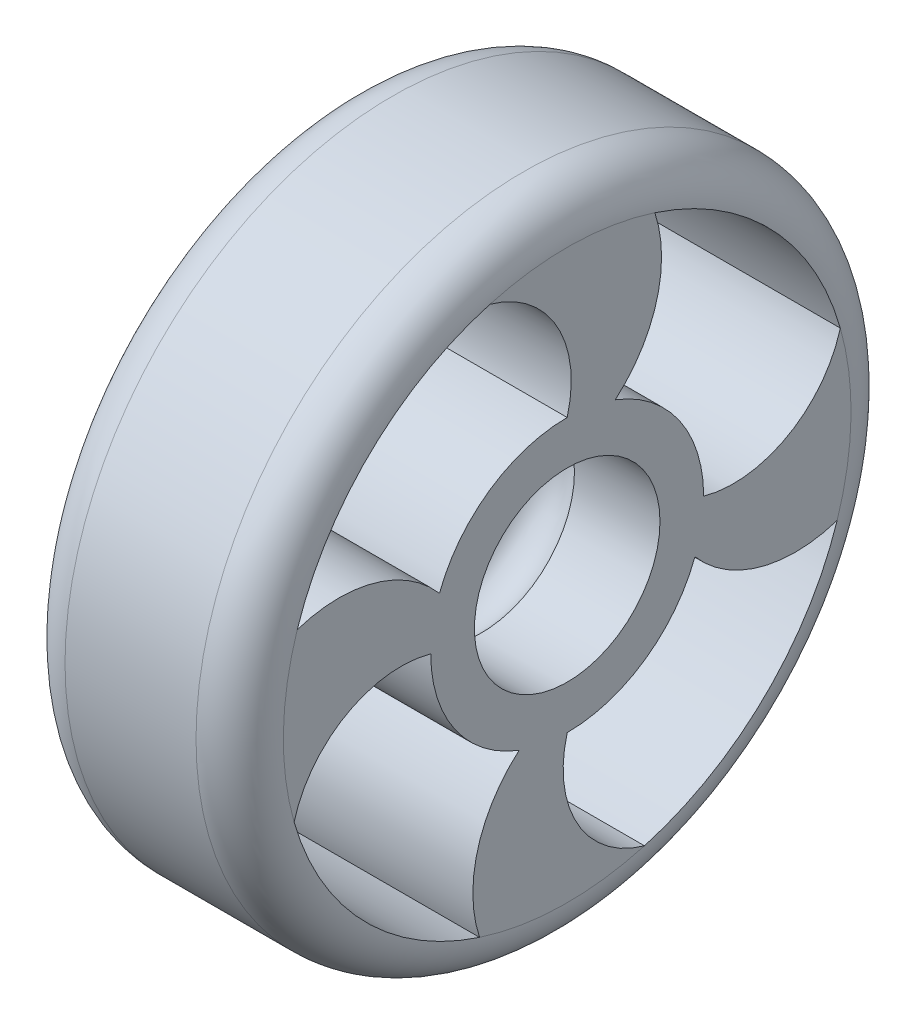
from build123d import *

# Parameters (mm, degrees)
SKETCH1_R           = 15.875
SKETCH1_R_2         = 10.795
BOSS_EXTRUDE1_DEPTH = 25.4
SKETCH2_R           = 38.1
BOSS_EXTRUDE2_DEPTH = 25.4
FILLET1_R           = 5.08


with BuildPart() as part:
    # Sketch1 → Boss-Extrude1 (new body)
    with BuildSketch(Plane(origin=(0, 0, 0), x_dir=(0, 0, -1), z_dir=(1, 0, 0))):
        with Locations(Location((0, 0, 0), (0, 0, 180))):
            Circle(SKETCH1_R)
        with Locations(Location((0, 0, 0), (0, 0, 180))):
            Circle(SKETCH1_R_2, mode=Mode.SUBTRACT)
    extrude(amount=BOSS_EXTRUDE1_DEPTH)

    # Sketch2 → Boss-Extrude2 (add)
    with BuildSketch(Plane.ZY):
        Circle(SKETCH2_R)
        with BuildLine():
            ThreePointArc((15.875, 0), (15.6190099, 2.839393375), (14.859295466, 5.587214267))
            ThreePointArc((14.859295466, 5.587214267), (22.431138125, 10.412171765), (31.406968253, 10.194250594))
            ThreePointArc((31.406968253, 10.194250594), (22.899884414, 23.788982615), (8.991124629, 31.772316219))
            ThreePointArc((8.991124629, 31.772316219), (1.203120323, 25.685780991), (0, 15.875))
            ThreePointArc((0, 15.875), (-2.839393375, 15.6190099), (-5.587214267, 14.859295466))
            ThreePointArc((-5.587214267, 14.859295466), (-10.412171765, 22.431138125), (-10.194250594, 31.406968253))
            ThreePointArc((-10.194250594, 31.406968253), (-23.788982615, 22.899884414), (-31.772316219, 8.991124629))
            ThreePointArc((-31.772316219, 8.991124629), (-25.685780991, 1.203120323), (-15.875, 0))
            ThreePointArc((-15.875, 0), (-15.6190099, -2.839393375), (-14.859295466, -5.587214267))
            ThreePointArc((-14.859295466, -5.587214267), (-22.431138125, -10.412171765), (-31.406968253, -10.194250594))
            ThreePointArc((-31.406968253, -10.194250594), (-22.899884414, -23.788982615), (-8.991124629, -31.772316219))
            ThreePointArc((-8.991124629, -31.772316219), (-1.203120323, -25.685780991), (0, -15.875))
            ThreePointArc((0, -15.875), (2.839393375, -15.6190099), (5.587214267, -14.859295466))
            ThreePointArc((5.587214267, -14.859295466), (10.412171765, -22.431138125), (10.194250594, -31.406968253))
            ThreePointArc((10.194250594, -31.406968253), (23.788982615, -22.899884414), (31.772316219, -8.991124629))
            ThreePointArc((31.772316219, -8.991124629), (25.685780991, -1.203120323), (15.875, 0))
        make_face(mode=Mode.SUBTRACT)
    extrude(amount=-BOSS_EXTRUDE2_DEPTH)

    # Cut-Sweep1: sweep along a curve in space
    with BuildLine() as cut_sweep1_path:
        ThreePointArc((25.4, 0, -10.795), (25.4, 7.633217703, -7.633217703), (25.4, 10.795, 0))
        ThreePointArc((25.4, 10.795, 0), (25.4, 7.633217703, 7.633217703), (25.4, 0, 10.795))
        ThreePointArc((25.4, 0, 10.795), (25.4, -7.633217703, 7.633217703), (25.4, -10.795, 0))
        ThreePointArc((25.4, -10.795, 0), (25.4, -7.633217703, -7.633217703), (25.4, 0, -10.795))
    # Sketch5 → Cut-Sweep1 (sweep, cut)
    with BuildSketch(Plane.XY):
        with BuildLine():
            Line((15.450320755, 10.793804114), (9.949679245, 10.793804114))
            ThreePointArc((9.949679245, 10.793804114), (12.7, 12.3825), (15.450320755, 10.793804114))
        make_face()
    sweep(path=cut_sweep1_path.line, mode=Mode.SUBTRACT)

    # Fillet1
    fillet1_edges = [part.edges().sort_by_distance(p)[0] for p in [
        (25.4, 0, -38.1),
        (0, 0, -38.1),
    ]]
    fillet(fillet1_edges, radius=FILLET1_R - 0.0001)  # a hair under: the kernel refuses the full size


solid = part.part
